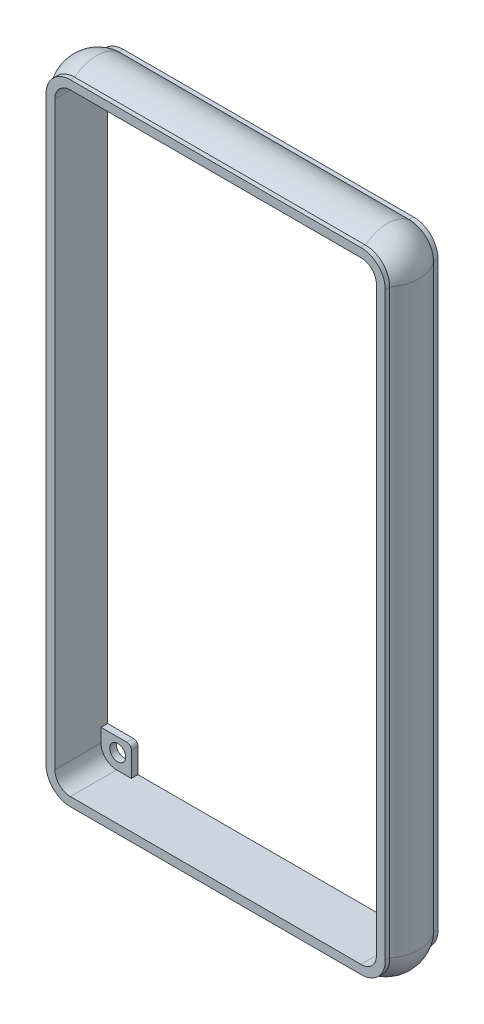
from build123d import *
from build123d.topology import SkipClean

# Parameters (mm, degrees)
BOSS_EXTRU_1_DEPTH      = 10
COQUE3_START            = 62.865
COQUE3_OUTLINE_W        = 139.150614233
COQUE3_OUTLINE_H        = 10
COQUE3_DEPTH            = 66.018297978
COQUE3_2_DEPTH          = 66.018297978
COQUE3_START_2          = 132.445419336
COQUE3_3_OUTLINE_W      = 139.150614233
COQUE3_3_OUTLINE_H      = 10
COQUE3_3_DEPTH          = 0.002588282
COQUE3_4_DEPTH          = 10
COQUE3_START_3          = -2
COQUE3_5_DEPTH          = 12
COQUE3_6_DEPTH          = 2
ENL_V_START             = -10
ENL_V_MAT_EXTRU_4_DEPTH = 10
ESQUISSE5_R             = 1.8
BOSS_EXTRU_2_DEPTH      = 1.5
ESQUISSE6_R             = 1.8
ESQUISSE6_R_2           = 1.809836942
BOSS_EXTRU_3_DEPTH      = 1.5


with BuildPart() as part:
    # Model → Boss.-Extru.1 (new body)
    with BuildSketch(Plane.XY):
        with BuildLine():
            Line((62.865, -88.241118767), (128.905, -88.241118767))
            ThreePointArc((128.905, -88.241118767), (131.433274754, -89.251885129), (132.445419336, -91.779608456))
            Line((132.445419336, -91.779608456), (132.445419336, -223.843779))
            ThreePointArc((132.445419336, -223.843779), (131.447277728, -226.393080044), (128.898176953, -227.391733))
            Line((128.898176953, -227.391733), (62.865, -227.391733))
            ThreePointArc((62.865, -227.391733), (60.366111032, -226.356659298), (59.33103733, -223.85777033))
            Line((59.33103733, -223.85777033), (59.33103733, -91.775081437))
            ThreePointArc((59.33103733, -91.775081437), (60.366111032, -89.276192468), (62.865, -88.241118767))
        make_face()
    extrude(amount=BOSS_EXTRU_1_DEPTH)

    # Coque3: read off the stored shape, not the designer's step
    # Coque3 outline → Coque3 (cut)
    with BuildSketch(Plane.YZ.offset(COQUE3_START)):
        with Locations((-157.816425884, 5)):
            Rectangle(COQUE3_OUTLINE_W, COQUE3_OUTLINE_H)
    extrude(amount=COQUE3_DEPTH, mode=Mode.SUBTRACT)

    # Coque3 2 outline → Coque3 2 (add)
    with BuildSketch(Plane.YZ.offset(COQUE3_START)):
        Polygon((-227.391733, 10), (-229.391733, 10), (-229.391733, -2), (-86.241118767, -2), (-86.241118767, 10), (-88.241118767, 10), (-88.241118767, 0), (-227.391733, 0), align=None)
    extrude(amount=COQUE3_2_DEPTH)

    # Coque3 3 outline → Coque3 3 (add)
    with BuildSketch(Plane.YZ.offset(COQUE3_START_2)):
        with Locations((-157.816425884, 5)):
            Rectangle(COQUE3_3_OUTLINE_W, COQUE3_3_OUTLINE_H)
    extrude(amount=COQUE3_3_DEPTH)

    # Coque3 4 outline → Coque3 4 (cut)
    with BuildSketch(Plane.XY):
        with BuildLine():
            Line((62.865, -227.391733), (62.865, -88.241118767))
            ThreePointArc((62.865, -88.241118767), (60.366111032, -89.276192468), (59.33103733, -91.775081437))
            Line((59.33103733, -91.775081437), (59.33103733, -223.85777033))
            ThreePointArc((59.33103733, -223.85777033), (60.366111032, -226.356659298), (62.865, -227.391733))
        make_face()
        with BuildLine():
            Line((128.905, -88.241118767), (128.883297978, -88.241118767))
            Line((128.883297978, -88.241118767), (128.883297978, -227.391733))
            Line((128.883297978, -227.391733), (128.898176953, -227.391733))
            ThreePointArc((128.898176953, -227.391733), (131.447277728, -226.393080044), (132.445419336, -223.843779))
            Line((132.445419336, -223.843779), (132.445419336, -91.779608456))
            ThreePointArc((132.445419336, -91.779608456), (131.433274754, -89.251885129), (128.905, -88.241118767))
        make_face()
    extrude(amount=COQUE3_4_DEPTH, mode=Mode.SUBTRACT)

    # Coque3 5 outline → Coque3 5 (add)
    with SkipClean():  # the faces are left unmerged after this step: merging them gives an invalid solid
        with BuildSketch(Plane.XY.offset(COQUE3_START_3)):
            with BuildLine():
                ThreePointArc((62.865, -86.241118767), (58.951897469, -87.861978906), (57.33103733, -91.775081437))
                Line((57.33103733, -91.775081437), (57.33103733, -223.85777033))
                ThreePointArc((57.33103733, -223.85777033), (58.951897469, -227.770872861), (62.865, -229.391733))
                Line((62.865, -229.391733), (62.865, -227.391733))
                ThreePointArc((62.865, -227.391733), (60.366111032, -226.356659298), (59.33103733, -223.85777033))
                Line((59.33103733, -223.85777033), (59.33103733, -91.775081437))
                ThreePointArc((59.33103733, -91.775081437), (60.366111032, -89.276192468), (62.865, -88.241118767))
                Line((62.865, -88.241118767), (62.865, -86.241118767))
            make_face()
            with BuildLine():
                Line((128.883297978, -86.241118767), (128.883297978, -88.241118767))
                Line((128.883297978, -88.241118767), (128.905, -88.241118767))
                ThreePointArc((128.905, -88.241118767), (131.433274754, -89.251885129), (132.445419336, -91.779608456))
                Line((132.445419336, -91.779608456), (132.445419336, -223.843779))
                ThreePointArc((132.445419336, -223.843779), (131.447277728, -226.393080044), (128.898176953, -227.391733))
                Line((128.898176953, -227.391733), (128.883297978, -227.391733))
                Line((128.883297978, -227.391733), (128.883297978, -229.391733))
                Line((128.883297978, -229.391733), (128.863893168, -229.391733))
                ThreePointArc((128.863893168, -229.391733), (132.861554056, -227.807230841), (134.445419336, -223.80931758))
                Line((134.445419336, -223.80931758), (134.445419336, -91.8008272))
                ThreePointArc((134.445419336, -91.8008272), (132.847317492, -87.837500742), (128.883297978, -86.241118767))
            make_face()
        extrude(amount=COQUE3_5_DEPTH)
    add(part.part.scale(1), mode=Mode.REPLACE)  # the faces are merged on a copy

    # Coque3 6 outline → Coque3 6 (add)
    with BuildSketch(Plane.XY.offset(COQUE3_START_3)):
        with BuildLine():
            Line((62.865, -227.391733), (62.865, -88.241118767))
            ThreePointArc((62.865, -88.241118767), (60.366111032, -89.276192468), (59.33103733, -91.775081437))
            Line((59.33103733, -91.775081437), (59.33103733, -223.85777033))
            ThreePointArc((59.33103733, -223.85777033), (60.366111032, -226.356659298), (62.865, -227.391733))
        make_face()
        with BuildLine():
            Line((128.905, -88.241118767), (128.883297978, -88.241118767))
            Line((128.883297978, -88.241118767), (128.883297978, -227.391733))
            Line((128.883297978, -227.391733), (128.898176953, -227.391733))
            ThreePointArc((128.898176953, -227.391733), (131.447277728, -226.393080044), (132.445419336, -223.843779))
            Line((132.445419336, -223.843779), (132.445419336, -91.779608456))
            ThreePointArc((132.445419336, -91.779608456), (131.433274754, -89.251885129), (128.905, -88.241118767))
        make_face()
    extrude(amount=COQUE3_6_DEPTH)

    # Esquisse3 → Enlèv. mat.-Extru.4 (cut)
    with BuildSketch(Plane.XY.offset(ENL_V_START)):
        with BuildLine():
            Line((62.865, -88.241118767), (128.905, -88.241118767))
            ThreePointArc((128.905, -88.241118767), (131.433274754, -89.251885129), (132.445419336, -91.779608456))
            Line((132.445419336, -91.779608456), (132.445419336, -223.843779))
            ThreePointArc((132.445419336, -223.843779), (131.447277728, -226.393080044), (128.898176953, -227.391733))
            Line((128.898176953, -227.391733), (62.865, -227.391733))
            ThreePointArc((62.865, -227.391733), (60.366111032, -226.356659298), (59.33103733, -223.85777033))
            Line((59.33103733, -223.85777033), (59.33103733, -91.775081437))
            ThreePointArc((59.33103733, -91.775081437), (60.366111032, -89.276192468), (62.865, -88.241118767))
        make_face()
    extrude(amount=ENL_V_MAT_EXTRU_4_DEPTH, mode=Mode.SUBTRACT)

    # Esquisse5 → Boss.-Extru.2 (add)
    # profile 1 of 2: a face of its own
    with SkipClean():  # the faces are left unmerged after this step: merging them gives an invalid solid
        with BuildSketch(Plane(origin=(0, 0, -2), x_dir=(-1, 0, 0), z_dir=(0, 0, -1))):
            with BuildLine():
                Line((-125.967795303, -88.736416121), (-125.967795303, -87.927030419))
                Line((-125.967795303, -87.927030419), (-130.489542498, -87.7228715))
                Line((-130.489542498, -87.7228715), (-132.246258772, -88.33172327))
                Line((-132.246258772, -88.33172327), (-132.913956121, -88.736416121))
                Line((-132.913956121, -88.736416121), (-132.913956121, -95.223579528))
                Line((-132.913956121, -95.223579528), (-126.967795303, -95.223579528))
                ThreePointArc((-126.967795303, -95.223579528), (-126.260688522, -94.93068631), (-125.967795303, -94.223579528))
                Line((-125.967795303, -94.223579528), (-125.967795303, -88.736416121))
            make_face()
            with Locations((-129.134006805, -92.465411844)):
                Circle(ESQUISSE5_R, mode=Mode.SUBTRACT)
        # profile 2 of 2: a face of its own
        with BuildSketch(Plane(origin=(0, 0, -2), x_dir=(-1, 0, 0), z_dir=(0, 0, -1))):
            with BuildLine():
                Line((-65.780502675, -88.736416121), (-65.780502675, -87.927030419))
                Line((-65.780502675, -87.927030419), (-61.258755481, -87.7228715))
                Line((-61.258755481, -87.7228715), (-59.502039206, -88.33172327))
                Line((-59.502039206, -88.33172327), (-58.834341857, -88.736416121))
                Line((-58.834341857, -88.736416121), (-58.834341857, -95.223579528))
                Line((-58.834341857, -95.223579528), (-64.780502675, -95.223579528))
                ThreePointArc((-64.780502675, -95.223579528), (-65.487609456, -94.93068631), (-65.780502675, -94.223579528))
                Line((-65.780502675, -94.223579528), (-65.780502675, -88.736416121))
            make_face()
            with Locations((-62.957500414, -92.551168532)):
                Circle(ESQUISSE5_R, mode=Mode.SUBTRACT)
        extrude(amount=-BOSS_EXTRU_2_DEPTH)

    # Esquisse6 → Boss.-Extru.3 (add)
    # profile 1 of 2: a face of its own
    with BuildSketch(Plane(origin=(0, 0, -2), x_dir=(-1, 0, 0), z_dir=(0, 0, -1))):
        with BuildLine():
            Line((-133.339427004, -220.765848966), (-126.504202764, -220.765848966))
            ThreePointArc((-126.504202764, -220.765848966), (-125.797095983, -221.058742184), (-125.504202764, -221.765848966))
            Line((-125.504202764, -221.765848966), (-125.504202764, -228.064085465))
            Line((-125.504202764, -228.064085465), (-130.16804847, -228.064085465))
            Line((-130.16804847, -228.064085465), (-131.733408387, -227.250911482))
            Line((-131.733408387, -227.250911482), (-133.339427004, -225.177317824))
            Line((-133.339427004, -225.177317824), (-133.339427004, -220.765848966))
        make_face()
        with Locations((-129.160770539, -223.765453407)):
            Circle(ESQUISSE6_R, mode=Mode.SUBTRACT)
    # profile 2 of 2: a face of its own
    with BuildSketch(Plane(origin=(0, 0, -2), x_dir=(-1, 0, 0), z_dir=(0, 0, -1))):
        with BuildLine():
            Line((-58.389466164, -225.177317824), (-58.389466164, -220.765848966))
            Line((-58.389466164, -220.765848966), (-65.224690404, -220.765848966))
            ThreePointArc((-65.224690404, -220.765848966), (-65.931797185, -221.058742184), (-66.224690404, -221.765848966))
            Line((-66.224690404, -221.765848966), (-66.224690404, -228.064085465))
            Line((-66.224690404, -228.064085465), (-61.560844698, -228.064085465))
            Line((-61.560844698, -228.064085465), (-59.995484781, -227.250911482))
            Line((-59.995484781, -227.250911482), (-58.389466164, -225.177317824))
        make_face()
        with Locations((-63.12082636, -223.851047054)):
            Circle(ESQUISSE6_R_2, mode=Mode.SUBTRACT)
    extrude(amount=-BOSS_EXTRU_3_DEPTH)

    # Balayage1: sweep along a path in Esquisse7
    with BuildLine(Plane.XY.offset(5)) as balayage1_path:
        Line((128.942747104, -230.887624532), (62.83103733, -230.887624532))
        ThreePointArc((62.83103733, -230.887624532), (57.881289862, -228.837372001), (55.83103733, -223.887624532))
        Line((55.83103733, -223.887624532), (55.83103733, -91.741118767))
        ThreePointArc((55.83103733, -91.741118767), (57.881289862, -86.791371299), (62.83103733, -84.741118767))
        Line((62.83103733, -84.741118767), (128.942747104, -84.741118767))
        ThreePointArc((128.942747104, -84.741118767), (133.892494572, -86.791371299), (135.942747104, -91.741118767))
        Line((135.942747104, -91.741118767), (135.942747104, -223.887624532))
        ThreePointArc((135.942747104, -223.887624532), (133.892494572, -228.837372001), (128.942747104, -230.887624532))
    # Esquisse8 → Balayage1 (sweep)
    with BuildSketch(Plane(origin=(0, -155, 0), x_dir=(1, 0, 0), z_dir=(0, 1, 0))):
        with BuildLine():
            Line((57.33103733, 1.001505866), (57.33103733, -9.003220236))
            ThreePointArc((57.33103733, -9.003220236), (55.579057649, -4.000857185), (57.33103733, 1.001505866))
        make_face()
    sweep(path=balayage1_path.line)


solid = part.part
